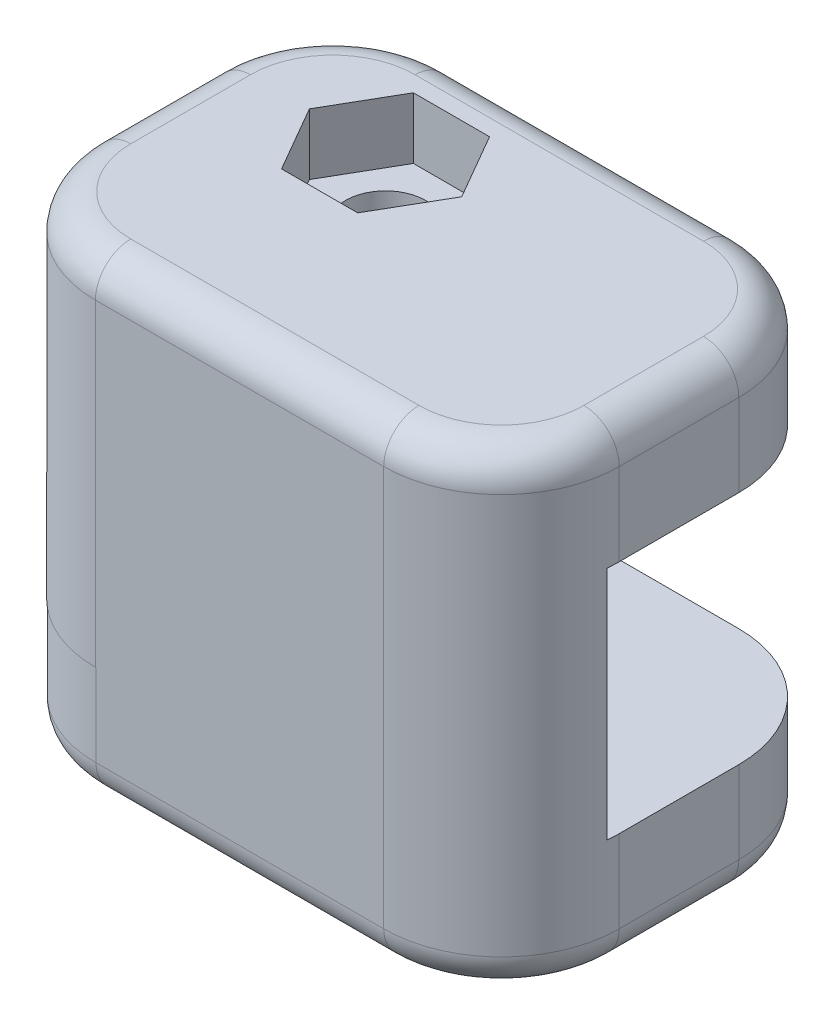
from build123d import *
from build123d.topology import SkipClean

# Parameters (mm, degrees)
SKETCH1_R           = 1.7
BOSS_EXTRUDE1_DEPTH = 5
BOSS_EXTRUDE2_START = -15
BOSS_EXTRUDE2_DEPTH = 15
SKETCH3_W           = 22.216419783
SKETCH3_H           = 5.578122697
CUT_EXTRUDE1_DEPTH  = 7
BOSS_EXTRUDE3_START = 5
SKETCH4_R           = 1.7
BOSS_EXTRUDE3_DEPTH = 5
CUT_EXTRUDE2_DEPTH  = 2.6
FILLET1_R           = 1.5


with BuildPart() as part:
    # Sketch1 → Boss-Extrude1 (new body)
    with BuildSketch(Plane(origin=(0, 0, 0), x_dir=(1, 0, 0), z_dir=(0, 1, 0))):
        with BuildLine():
            Line((0, 5), (10, 5))
            ThreePointArc((10, 5), (13.535533906, 3.535533906), (15, 0))
            Line((15, 0), (15, -5.078122697))
            ThreePointArc((15, -5.078122697), (13.535533906, -8.613656603), (10, -10.078122697))
            Line((10, -10.078122697), (-2.241482597, -10.078122697))
            ThreePointArc((-2.241482597, -10.078122697), (-5.777016503, -8.613656603), (-7.241482597, -5.078122697))
            Line((-7.241482597, -5.078122697), (-7.241482597, 0))
            ThreePointArc((-7.241482597, 0), (-5.777016503, 3.535533906), (-2.241482597, 5))
            Line((-2.241482597, 5), (0, 5))
        make_face()
        Circle(SKETCH1_R, mode=Mode.SUBTRACT)
    extrude(amount=BOSS_EXTRUDE1_DEPTH)

    # Sketch2 → Boss-Extrude2 (add)
    with SkipClean():  # the faces are left unmerged after this step: merging them gives an invalid solid
        with BuildSketch(Plane(origin=(0, 5, 0), x_dir=(1, 0, 0), z_dir=(0, 1, 0)).offset(BOSS_EXTRUDE2_START)):
            with BuildLine():
                Line((-5.578122697, 0), (-7.241482597, 0))
                Line((-7.241482597, 0), (-7.241482597, -5.078122697))
                ThreePointArc((-7.241482597, -5.078122697), (-5.777016503, -8.613656603), (-2.241482597, -10.078122697))
                Line((-2.241482597, -10.078122697), (10, -10.078122697))
                ThreePointArc((10, -10.078122697), (13.354101966, -8.78622194), (14.974937186, -5.578122697))
                Line((14.974937186, -5.578122697), (0, -5.578122697))
                ThreePointArc((0, -5.578122697), (-3.944328385, -3.944328385), (-5.578122697, 0))
            make_face()
        extrude(amount=BOSS_EXTRUDE2_DEPTH)
    add(part.part.scale(1), mode=Mode.REPLACE)  # the faces are merged on a copy

    # Sketch3 → Cut-Extrude1 (cut)
    with BuildSketch(Plane(origin=(0, -10, 0), x_dir=(-1, 0, 0), z_dir=(0, -1, 0))):
        with Locations((-3.866727295, -2.789061349)):
            Rectangle(SKETCH3_W, SKETCH3_H)
    extrude(amount=-CUT_EXTRUDE1_DEPTH, mode=Mode.SUBTRACT)

    # Sketch4 → Boss-Extrude3 (add)
    with BuildSketch(Plane.XZ.offset(10).offset(BOSS_EXTRUDE3_START)):
        with BuildLine():
            Line((10, -5), (-2.216419783, -5))
            ThreePointArc((-2.216419783, -5), (-5.751953689, -3.535533906), (-7.216419783, 0))
            Line((-7.216419783, 0), (-7.216419783, 5.078122697))
            ThreePointArc((-7.216419783, 5.078122697), (-5.751953689, 8.613656603), (-2.216419783, 10.078122697))
            Line((-2.216419783, 10.078122697), (10, 10.078122697))
            ThreePointArc((10, 10.078122697), (13.535533906, 8.613656603), (15, 5.078122697))
            Line((15, 5.078122697), (15, 0))
            ThreePointArc((15, 0), (13.535533906, -3.535533906), (10, -5))
        make_face()
        Circle(SKETCH4_R, mode=Mode.SUBTRACT)
    extrude(amount=-BOSS_EXTRUDE3_DEPTH)

    # Sketch5 → Cut-Extrude2 (cut)
    with BuildSketch(Plane(origin=(0, 5, 0), x_dir=(1, 0, 0), z_dir=(0, 1, 0))):
        Polygon((3.233161507, 0), (1.616580754, 2.8), (-1.616580754, 2.8), (-3.233161507, 0), (-1.616580754, -2.8), (1.616580754, -2.8), align=None)
    extrude(amount=-CUT_EXTRUDE2_DEPTH, mode=Mode.SUBTRACT)

    # Fillet1
    fillet1_edges = [part.edges().sort_by_distance(p)[0] for p in [
        (3.891790109, -15, -5),
        (-5.751953689, -15, -3.535533906),
        (-7.216419783, -15, 2.539061348),
        (-5.751953689, -15, 8.613656603),
        (3.891790109, -15, 10.078122697),
        (13.535533906, -15, 8.613656603),
        (15, -15, 2.539061348),
        (15, 5, 2.539061348),
        (13.535533906, 5, 8.613656603),
        (3.879258701, 5, 10.078122697),
        (-5.777016503, 5, 8.613656603),
        (-7.241482597, 5, 2.539061348),
        (-5.777016503, 5, -3.535533906),
        (3.879258701, 5, -5),
        (13.535533906, -15, -3.535533906),
        (13.535533906, 5, -3.535533906),
    ]]
    fillet(fillet1_edges, radius=FILLET1_R)


solid = part.part
